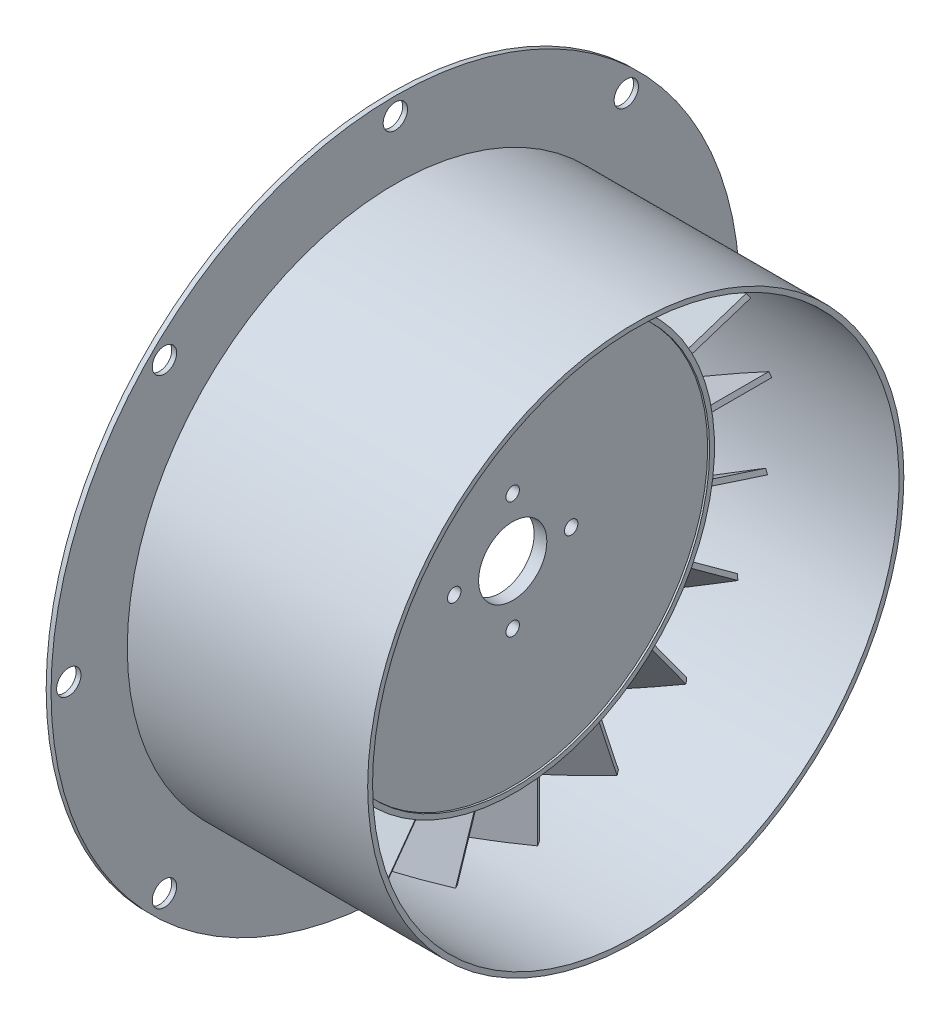
from build123d import *

# Parameters (mm, degrees)
BOSS_EXTRUDE1_REACH        = 166.235
BOSS_EXTRUDE1_START_RADIUS = 52.07
BOSS_EXTRUDE1_END_RADIUS   = 52.07
CIRPATTERN15_COUNT         = 20
SKETCH7_R                  = 1.7526
SKETCH7_R_2                = 8.89
CUT_EXTRUDE1_DEPTH         = 102.14463705
SKETCH9_R                  = 3.175
CUT_EXTRUDE2_DEPTH         = 2.54


with BuildPart() as part:
    # Sketch1 → Revolve1 (revolve)
    with BuildSketch(Plane(origin=(0, 0, 0), x_dir=(1, 0, 0), z_dir=(0, 1, 0))):
        Polygon((3.302, 0), (3.302, 50.8), (3.81, 50.8), (3.81, 52.07), (-25.4, 52.07), (-25.4, 50.8), (0, 50.8), (0, 0), align=None)
    revolve(axis=Axis((0, 0, 0), (1, 0, 0)))

    # Boss-Extrude1: from a cylinder face, 166.235 long prism both ways, kept between that surface and its translate by the depth
    boss_extrude1_start = Plane(origin=(-10.795, 0, 0), z_dir=(-1, 0, 0)) * Cylinder(BOSS_EXTRUDE1_START_RADIUS, 437.61, mode=Mode.PRIVATE)
    boss_extrude1_end = Plane(origin=(-10.795, 0, 16.51), z_dir=(-1, 0, 0)) * Cylinder(BOSS_EXTRUDE1_END_RADIUS, 437.61, mode=Mode.PRIVATE)
    # Sketch2 → Boss-Extrude1 (add, from a surface)
    with BuildSketch(Plane.XY.offset(83.82), mode=Mode.PRIVATE) as boss_extrude1_sk1:
        Polygon((-24.310727154, 7.070073869), (2.085727154, -8.169926131), (2.720727154, -7.070073869), (-23.675727154, 8.169926131), align=None)
    boss_extrude1_tool1 = extrude(boss_extrude1_sk1.sketch, amount=BOSS_EXTRUDE1_REACH, both=True, mode=Mode.PRIVATE)
    boss_extrude1 = ((boss_extrude1_tool1 - boss_extrude1_start) & boss_extrude1_end).solids().sort_by_distance((-25.4, 0, 52.07))[0]
    add(boss_extrude1)

    # CirPattern15: Boss-Extrude1 ×20 about axis
    cirpattern15_axis = Axis((3.81, 0, 0), (-1, 0, 0))
    for i in range(1, CIRPATTERN15_COUNT):
        add(boss_extrude1.rotate(cirpattern15_axis, i * 360 / CIRPATTERN15_COUNT))

    # Sketch7 → Cut-Extrude1 (cut, through all)
    with BuildSketch(Plane(origin=(3.302, 0, 0), x_dir=(0, 0, -1), z_dir=(1, 0, 0))):
        with Locations((0, 15.24)):
            Circle(SKETCH7_R)
        Circle(SKETCH7_R_2)
        with Locations((15.24, 0)):
            Circle(SKETCH7_R)
        with Locations((0, -15.24)):
            Circle(SKETCH7_R)
        with Locations((-15.24, 0)):
            Circle(SKETCH7_R)
    extrude(amount=-CUT_EXTRUDE1_DEPTH, mode=Mode.SUBTRACT)


with BuildPart() as body_2:
    # Sketch8 → Revolve2 (revolve)
    with BuildSketch(Plane.XY):
        Polygon((35.360589781, 69.85), (35.360589781, 68.58), (-28.539332901, 68.58), (-28.539332901, 89.716824123), (-27.269332901, 89.716824123), (-27.269332901, 69.85), align=None)
    revolve(axis=Axis((0, 0, 0), (1, 0, 0)))

    # Sketch9 → Cut-Extrude2 (cut)
    with BuildSketch(Plane(origin=(-27.269332901, 0, 0), x_dir=(0, 0, -1), z_dir=(1, 0, 0))):
        with Locations((0, 85.09)):
            Circle(SKETCH9_R)
        with Locations((60.167716011, 60.167716011)):
            Circle(SKETCH9_R)
        with Locations((85.09, 0)):
            Circle(SKETCH9_R)
        with Locations((60.167716011, -60.167716011)):
            Circle(SKETCH9_R)
        with Locations((0, -85.09)):
            Circle(SKETCH9_R)
        with Locations((-60.167716011, -60.167716011)):
            Circle(SKETCH9_R)
        with Locations((-85.09, 0)):
            Circle(SKETCH9_R)
        with Locations((-60.167716011, 60.167716011)):
            Circle(SKETCH9_R)
    extrude(amount=-CUT_EXTRUDE2_DEPTH, mode=Mode.SUBTRACT)


solid = Compound([part.part, body_2.part])
